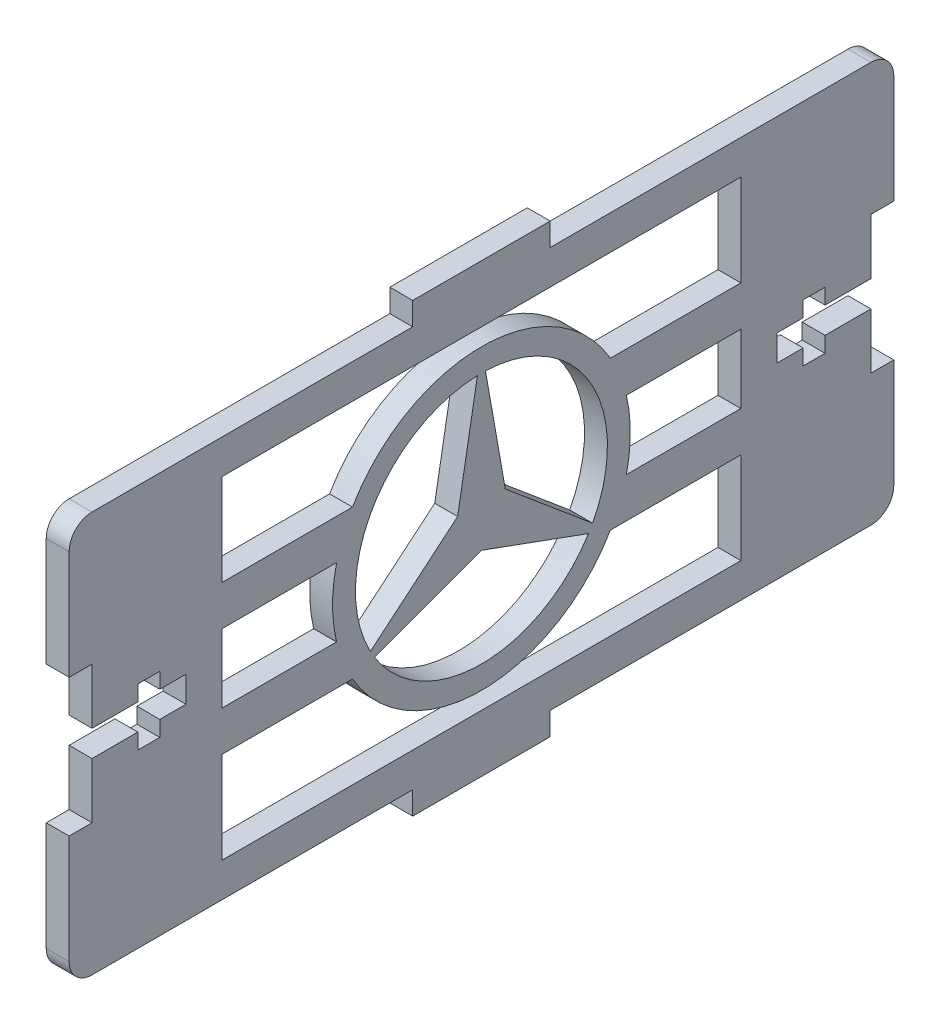
from build123d import *

# Parameters (mm, degrees)
BOSS_EXTRUDE1_DEPTH = 2.54
FILLET1_R           = 2.54
CUT_EXTRUDE2_REACH  = 54.058
CUT_EXTRUDE3_DEPTH  = 2.54


with BuildPart() as part:
    # Sketch2 → Boss-Extrude1 (new body)
    with BuildSketch(Plane(origin=(0, 0, 0), x_dir=(0, 0, -1), z_dir=(1, 0, 0))):
        Polygon((-45.72, 22.225), (-45.72, 7.62), (-43.18, 7.62), (-43.18, 1.4478), (-38.1, 1.4478), (-38.1, 3.175), (-35.66795, 3.175), (-35.66795, 1.4478), (-32.766, 1.4478), (-32.766, -1.4478), (-35.66795, -1.4478), (-35.66795, -3.175), (-38.1, -3.175), (-38.1, -1.4478), (-43.18, -1.4478), (-43.18, -7.62), (-45.72, -7.62), (-45.72, -22.225), (-7.62, -22.225), (-7.62, -24.765), (7.62, -24.765), (7.62, -22.225), (45.72, -22.225), (45.72, -7.62), (43.18, -7.62), (43.18, -1.4478), (38.1, -1.4478), (38.1, -3.175), (35.66795, -3.175), (35.66795, -1.4478), (32.766, -1.4478), (32.766, 1.4478), (35.66795, 1.4478), (35.66795, 3.175), (38.1, 3.175), (38.1, 1.4478), (43.18, 1.4478), (43.18, 7.62), (45.72, 7.62), (45.72, 22.225), (7.62, 22.225), (7.62, 24.765), (-7.62, 24.765), (-7.62, 22.225), align=None)
    extrude(amount=BOSS_EXTRUDE1_DEPTH)

    # Fillet1
    fillet1_edges = [part.edges().sort_by_distance(p)[0] for p in [
        (1.27, -22.225, 45.72),
        (1.27, -22.225, -45.72),
        (1.27, 22.225, -45.72),
        (1.27, 22.225, 45.72),
    ]]
    fillet(fillet1_edges, radius=FILLET1_R)

    # Sketch3 → Cut-Extrude2 (cut, up to next)
    with BuildSketch(Plane(origin=(2.54, 0, 0), x_dir=(0, 0, -1), z_dir=(1, 0, 0)), mode=Mode.PRIVATE) as cut_extrude2_sk1:
        with BuildLine():
            Line((2.639645431, 1.524), (12.316467203, -6.592839725))
            ThreePointArc((12.316467203, -6.592839725), (12.098374891, 6.985), (0.448666916, 13.962793345))
            Line((0.448666916, 13.962793345), (2.639645431, 1.524))
        make_face()
    cut_extrude2_tool1 = extrude(cut_extrude2_sk1.sketch, amount=-CUT_EXTRUDE2_REACH, mode=Mode.PRIVATE) & part.part
    # Sketch3 → Cut-Extrude2 (cut, up to next)
    with BuildSketch(Plane(origin=(2.54, 0, 0), x_dir=(0, 0, -1), z_dir=(1, 0, 0)), mode=Mode.PRIVATE) as cut_extrude2_sk2:
        with BuildLine():
            Line((0, -3.048), (11.867800287, -7.36995362))
            ThreePointArc((11.867800287, -7.36995362), (0, -13.97), (-11.867800287, -7.36995362))
            Line((-11.867800287, -7.36995362), (0, -3.048))
        make_face()
    cut_extrude2_tool2 = extrude(cut_extrude2_sk2.sketch, amount=-CUT_EXTRUDE2_REACH, mode=Mode.PRIVATE) & part.part
    # Sketch3 → Cut-Extrude2 (cut, up to next)
    with BuildSketch(Plane(origin=(2.54, 0, 0), x_dir=(0, 0, -1), z_dir=(1, 0, 0)), mode=Mode.PRIVATE) as cut_extrude2_sk3:
        with BuildLine():
            Line((-2.639645431, 1.524), (-0.448666916, 13.962793345))
            ThreePointArc((-0.448666916, 13.962793345), (-12.098374891, 6.985), (-12.316467203, -6.592839725))
            Line((-12.316467203, -6.592839725), (-2.639645431, 1.524))
        make_face()
    cut_extrude2_tool3 = extrude(cut_extrude2_sk3.sketch, amount=-CUT_EXTRUDE2_REACH, mode=Mode.PRIVATE) & part.part
    add(cut_extrude2_tool1.solids().sort_by_distance((2.54, 4.379888, -7.586189))[0], mode=Mode.SUBTRACT)
    add(cut_extrude2_tool2.solids().sort_by_distance((2.54, -8.759776, 0))[0], mode=Mode.SUBTRACT)
    add(cut_extrude2_tool3.solids().sort_by_distance((2.54, 4.379888, 7.586189))[0], mode=Mode.SUBTRACT)

    # Sketch4 → Cut-Extrude3 (cut)
    with BuildSketch(Plane(origin=(2.54, 0, 0), x_dir=(0, 0, -1), z_dir=(1, 0, 0))):
        with BuildLine():
            Line((-28.764370514, 18.415), (28.764370514, 18.415))
            Line((28.764370514, 18.415), (28.764370514, 8.255))
            Line((28.764370514, 8.255), (14.298079416, 8.255))
            ThreePointArc((14.298079416, 8.255), (0, 16.51), (-14.298079416, 8.255))
            Line((-14.298079416, 8.255), (-28.764370514, 8.255))
            Line((-28.764370514, 8.255), (-28.764370514, 18.415))
        make_face()
        with BuildLine():
            Line((-28.764370514, -18.415), (-28.764370514, -8.255))
            Line((-28.764370514, -8.255), (-14.298079416, -8.255))
            ThreePointArc((-14.298079416, -8.255), (0, -16.51), (14.298079416, -8.255))
            Line((14.298079416, -8.255), (28.764370514, -8.255))
            Line((28.764370514, -8.255), (28.764370514, -18.415))
            Line((28.764370514, -18.415), (-28.764370514, -18.415))
        make_face()
        with BuildLine():
            Line((-16.064370514, 3.81), (-28.764370514, 3.81))
            Line((-28.764370514, 3.81), (-28.764370514, -3.81))
            Line((-28.764370514, -3.81), (-16.064370514, -3.81))
            ThreePointArc((-16.064370514, -3.81), (-16.51, 0), (-16.064370514, 3.81))
        make_face()
        with BuildLine():
            Line((28.764370514, -3.81), (16.064370514, -3.81))
            ThreePointArc((16.064370514, -3.81), (16.51, 0), (16.064370514, 3.81))
            Line((16.064370514, 3.81), (28.764370514, 3.81))
            Line((28.764370514, 3.81), (28.764370514, -3.81))
        make_face()
    extrude(amount=-CUT_EXTRUDE3_DEPTH, mode=Mode.SUBTRACT)


solid = part.part
